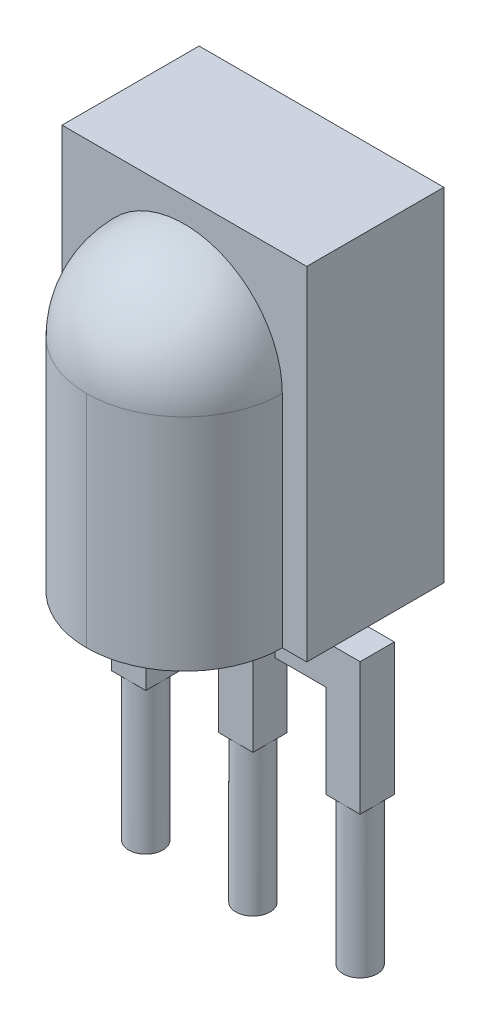
from build123d import *

# Parameters (mm, degrees)
SCHIZZO1_W                   = 5
SCHIZZO1_H                   = 2.8
ESTRUSIONE_ESTRUSIONE1_DEPTH = 7
ESTRUSIONE_ESTRUSIONE2_DEPTH = 2
RACCORDO1_R                  = 2
SCHIZZO3_W                   = 0.7
SCHIZZO3_H                   = 0.7
ESTRUSIONE_ESTRUSIONE3_DEPTH = 0.5
SCHIZZO4_W                   = 1.74
SCHIZZO4_H                   = 0.7
SCHIZZO4_W_2                 = 0.7
ESTRUSIONE_ESTRUSIONE4_DEPTH = 0.8
SCHIZZO5_W                   = 0.7
SCHIZZO5_H                   = 0.7
ESTRUSIONE_ESTRUSIONE5_DEPTH = 1.9
SCHIZZO6_R                   = 0.35
ESTRUSIONE_ESTRUSIONE6_DEPTH = 3


with BuildPart() as part:
    # Schizzo1 → Estrusione-Estrusione1 (new body)
    with BuildSketch(Plane(origin=(0, 0, 0), x_dir=(1, 0, 0), z_dir=(0, 1, 0))):
        with Locations((2.5, 1.4)):
            Rectangle(SCHIZZO1_W, SCHIZZO1_H)
    extrude(amount=ESTRUSIONE_ESTRUSIONE1_DEPTH)

    # Schizzo2 → Estrusione-Estrusione2 (add)
    with BuildSketch(Plane.XY):
        with BuildLine():
            Line((0.5, 0), (4.5, 0))
            Line((4.5, 0), (4.5, 4.5))
            ThreePointArc((4.5, 4.5), (2.5, 6.5), (0.5, 4.5))
            Line((0.5, 4.5), (0.5, 0))
        make_face()
    extrude(amount=ESTRUSIONE_ESTRUSIONE2_DEPTH)

    # Raccordo1
    raccordo1_edges = [part.edges().sort_by_distance(p)[0] for p in [
        (4.5, 2.25, 2),
        (0.5, 2.25, 2),
        (2.5, 6.5, 2),
    ]]
    fillet(raccordo1_edges, radius=RACCORDO1_R - 0.0001)  # a hair under: the kernel refuses the full size

    # Schizzo3 → Estrusione-Estrusione3 (add)
    with BuildSketch(Plane(origin=(0, 0, 0), x_dir=(-1, 0, 0), z_dir=(0, -1, 0))):
        with Locations((-1.35, 1.4)):
            Rectangle(SCHIZZO3_W, SCHIZZO3_H)
        with Locations((-2.5, 1.4)):
            Rectangle(SCHIZZO3_W, SCHIZZO3_H)
        with Locations((-3.65, 1.4)):
            Rectangle(SCHIZZO3_W, SCHIZZO3_H)
    extrude(amount=ESTRUSIONE_ESTRUSIONE3_DEPTH)

    # Schizzo4 → Estrusione-Estrusione4 (add)
    with BuildSketch(Plane(origin=(0, -0.5, 0), x_dir=(-1, 0, 0), z_dir=(0, -1, 0))):
        with Locations((-0.83, 1.4)):
            Rectangle(SCHIZZO4_W, SCHIZZO4_H)
        with Locations((-2.5, 1.4)):
            Rectangle(SCHIZZO4_W_2, SCHIZZO4_H)
        with Locations((-4.17, 1.4)):
            Rectangle(SCHIZZO4_W, SCHIZZO4_H)
    extrude(amount=ESTRUSIONE_ESTRUSIONE4_DEPTH)

    # Schizzo5 → Estrusione-Estrusione5 (add)
    with BuildSketch(Plane.XZ.offset(1.3)):
        with Locations((0.31, -1.4)):
            Rectangle(SCHIZZO5_W, SCHIZZO5_H)
        with Locations((4.69, -1.4)):
            Rectangle(SCHIZZO5_W, SCHIZZO5_H)
        with Locations((2.5, -1.4)):
            Rectangle(SCHIZZO5_W, SCHIZZO5_H)
    extrude(amount=ESTRUSIONE_ESTRUSIONE5_DEPTH)

    # Schizzo6 → Estrusione-Estrusione6 (add)
    with BuildSketch(Plane.XZ.offset(3.2)):
        with Locations(Location((0.31, -1.4, 0), (0, 0, 270))):
            Circle(SCHIZZO6_R)
        with Locations(Location((2.5, -1.4, 0), (0, 0, 270))):
            Circle(SCHIZZO6_R)
        with Locations(Location((4.69, -1.4, 0), (0, 0, 270))):
            Circle(SCHIZZO6_R)
    extrude(amount=ESTRUSIONE_ESTRUSIONE6_DEPTH)


solid = part.part
